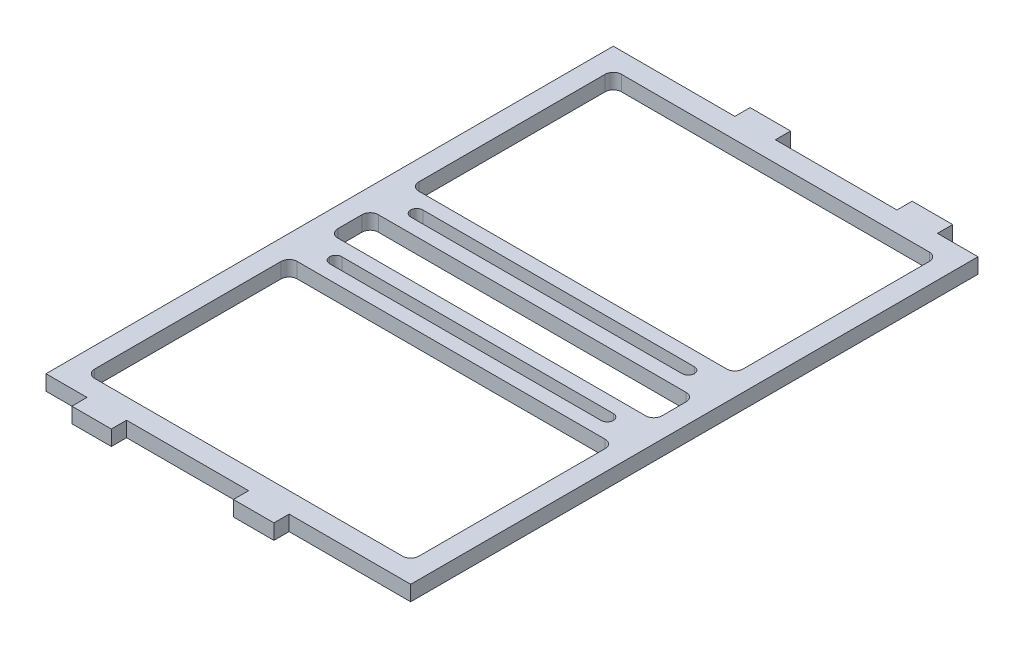
from build123d import *

# Parameters (mm, degrees)
SKETCH1_W           = 114.3
SKETCH1_H           = 177.8
SKETCH1_W_2         = 101.6
SKETCH1_H_2         = 165.1
BOSS_EXTRUDE1_DEPTH = 4.7625
SKETCH2_W           = 12.38677804
SKETCH2_H           = 4.7625
SKETCH2_W_2         = 12.7
BOSS_EXTRUDE2_DEPTH = 4.7625
SKETCH3_W           = 12.7
SKETCH3_H           = 4.7625
BOSS_EXTRUDE3_DEPTH = 4.7625
SKETCH7_W           = 114.3
SKETCH7_H           = 12.7
SKETCH7_W_2         = 88.9
SKETCH7_H_2         = 3.81
BOSS_EXTRUDE5_DEPTH = 4.7625
FILLET1_R           = 2.54
FILLET2_R           = 1.905


with BuildPart() as part:
    # Sketch1 → Boss-Extrude1 (new body)
    with BuildSketch(Plane(origin=(0, 0, 0), x_dir=(1, 0, 0), z_dir=(0, 1, 0))):
        Rectangle(SKETCH1_W, SKETCH1_H)
        Rectangle(SKETCH1_W_2, SKETCH1_H_2, mode=Mode.SUBTRACT)
    extrude(amount=BOSS_EXTRUDE1_DEPTH)

    # Sketch2 → Boss-Extrude2 (add)
    with BuildSketch(Plane.XY.offset(88.9)):
        with Locations((-38.1, 2.38125)):
            Rectangle(SKETCH2_W, SKETCH2_H)
        with Locations((12.7, 2.38125)):
            Rectangle(SKETCH2_W_2, SKETCH2_H)
    extrude(amount=BOSS_EXTRUDE2_DEPTH)

    # Sketch3 → Boss-Extrude3 (add)
    with BuildSketch(Plane(origin=(0, 0, -88.9), x_dir=(-1, 0, 0), z_dir=(0, 0, -1))):
        with Locations((-38.1, 2.38125)):
            Rectangle(SKETCH3_W, SKETCH3_H)
        with Locations((12.7, 2.38125)):
            Rectangle(SKETCH3_W, SKETCH3_H)
    extrude(amount=BOSS_EXTRUDE3_DEPTH)

    # Sketch7 → Boss-Extrude5 (add)
    # profile 1 of 2: a face of its own
    with BuildSketch(Plane(origin=(0, 4.7625, 0), x_dir=(1, 0, 0), z_dir=(0, 1, 0))):
        with Locations((0, 12.7)):
            Rectangle(SKETCH7_W, SKETCH7_H)
        with Locations((0, 12.7)):
            Rectangle(SKETCH7_W_2, SKETCH7_H_2, mode=Mode.SUBTRACT)
    # profile 2 of 2: a face of its own
    with BuildSketch(Plane(origin=(0, 4.7625, 0), x_dir=(1, 0, 0), z_dir=(0, 1, 0))):
        with Locations((0, -12.7)):
            Rectangle(SKETCH7_W, SKETCH7_H)
        with Locations((0, -12.7)):
            Rectangle(SKETCH7_W_2, SKETCH7_H_2, mode=Mode.SUBTRACT)
    extrude(amount=-BOSS_EXTRUDE5_DEPTH)

    # Fillet1
    fillet1_edges = [part.edges().sort_by_distance(p)[0] for p in [
        (50.8, 2.38125, -19.05),
        (50.8, 2.38125, -6.35),
        (-50.8, 2.38125, 19.05),
        (-50.8, 2.38125, 6.35),
        (50.8, 2.38125, 6.35),
        (50.8, 2.38125, 19.05),
        (50.8, 2.38125, 82.55),
        (50.8, 2.38125, -82.55),
        (-50.8, 2.38125, -82.55),
        (-50.8, 2.38125, 82.55),
        (-50.8, 2.38125, -6.35),
        (-50.8, 2.38125, -19.05),
    ]]
    fillet(fillet1_edges, radius=FILLET1_R)

    # Fillet2
    fillet2_edges = [part.edges().sort_by_distance(p)[0] for p in [
        (-44.45, 2.38125, -10.795),
        (-44.45, 2.38125, -14.605),
        (44.45, 2.38125, -10.795),
        (44.45, 2.38125, -14.605),
        (44.45, 2.38125, 14.605),
        (44.45, 2.38125, 10.795),
        (-44.45, 2.38125, 14.605),
        (-44.45, 2.38125, 10.795),
    ]]
    fillet(fillet2_edges, radius=FILLET2_R - 0.0001)  # a hair under: the kernel refuses the full size


solid = part.part
